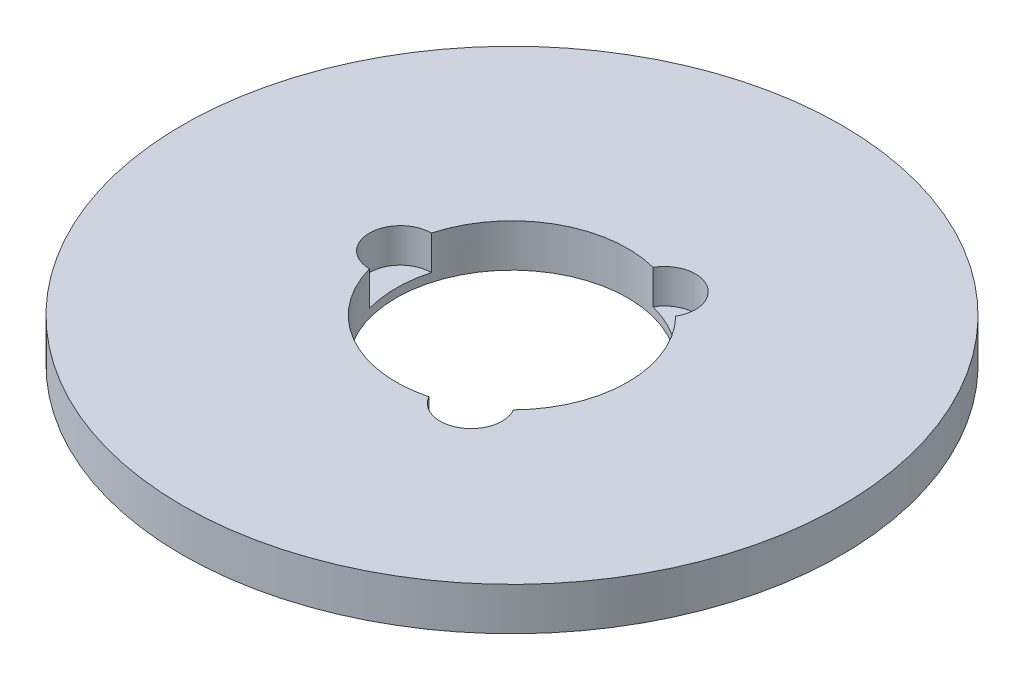
from build123d import *

# Parameters (mm, degrees)
SKETCH1_R           = 92.5
BOSS_EXTRUDE1_DEPTH = 12
SKETCH2_R           = 32.5
CUT_EXTRUDE1_DEPTH  = 132.363998112
SKETCH3_R           = 8.692751427
CUT_EXTRUDE2_DEPTH  = 9.610296575
CIRPATTERN1_COUNT   = 3


with BuildPart() as part:
    # Sketch1 → Boss-Extrude1 (new body)
    with BuildSketch(Plane(origin=(0, 0, 0), x_dir=(1, 0, 0), z_dir=(0, 1, 0))):
        Circle(SKETCH1_R)
    extrude(amount=BOSS_EXTRUDE1_DEPTH)

    # Sketch2 → Cut-Extrude1 (cut, through all)
    with BuildSketch(Plane(origin=(0, 0, 0), x_dir=(1, 0, 0), z_dir=(0, 1, 0))):
        Circle(SKETCH2_R)
    extrude(amount=CUT_EXTRUDE1_DEPTH, mode=Mode.SUBTRACT)

    # Sketch3 → Cut-Extrude2 (cut)
    with BuildSketch(Plane(origin=(0, 12, 0), x_dir=(1, 0, 0), z_dir=(0, 1, 0))):
        with Locations((-31.322186797, 0)):
            Circle(SKETCH3_R)
    cut_extrude2 = extrude(amount=-CUT_EXTRUDE2_DEPTH, mode=Mode.SUBTRACT)

    # CirPattern1: Cut-Extrude2 ×3 about axis
    cirpattern1_axis = Axis((0, 0, 0), (0, 1, 0))
    for i in range(1, CIRPATTERN1_COUNT):
        add(cut_extrude2.rotate(cirpattern1_axis, i * 360 / CIRPATTERN1_COUNT), mode=Mode.SUBTRACT)


solid = part.part
